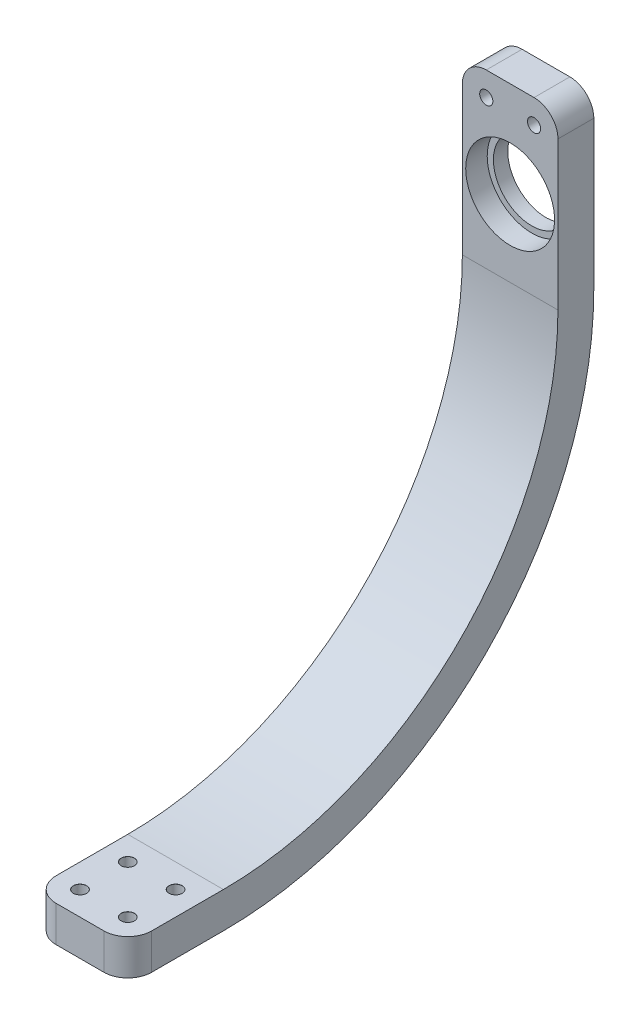
from build123d import *

# Parameters (mm, degrees)
BOSS_EXTRUDE2_DEPTH            = 40
M5_CLEARANCE_HOLE2_D           = 5.5
M5_CLEARANCE_HOLE2_CSINK_D     = 5.55
M5_CLEARANCE_HOLE2_CSINK_ANGLE = 90
CUT_EXTRUDE1_REACH             = 303.917
SKETCH10_R                     = 16
SKETCH11_R                     = 18.6
CUT_EXTRUDE2_DEPTH             = 9
FILLET1_R                      = 10
M5_CLEARANCE_HOLE3_D           = 5.5
M5_CLEARANCE_HOLE3_CSINK_D     = 5.55
M5_CLEARANCE_HOLE3_CSINK_ANGLE = 90


with BuildPart() as part:
    # Sketch6 → Boss-Extrude2 (new body)
    with BuildSketch(Plane(origin=(0, 0, 0), x_dir=(0, 0, -1), z_dir=(1, 0, 0))):
        with BuildLine():
            Line((0, 0), (40, 0))
            ThreePointArc((40, 0), (149.601551084, 45.398448916), (195, 155))
            Line((195, 155), (195, 227))
            Line((195, 227), (180, 227))
            Line((180, 227), (180, 155))
            ThreePointArc((180, 155), (138.994949366, 56.005050634), (40, 15))
            Line((40, 15), (0, 15))
            Line((0, 15), (0, 0))
        make_face()
    extrude(amount=BOSS_EXTRUDE2_DEPTH)

    # M5 Clearance Hole2 (through all)
    with Locations(Plane(origin=(0, 15, 0), x_dir=(1, 0, 0), z_dir=(0, 1, 0))):
        with Locations((10, 30), (30, 30), (10, 10), (30, 10)):
            CounterSinkHole(M5_CLEARANCE_HOLE2_D / 2, M5_CLEARANCE_HOLE2_CSINK_D / 2, counter_sink_angle=M5_CLEARANCE_HOLE2_CSINK_ANGLE)

    # Sketch10 → Cut-Extrude1 (cut, up to next)
    with BuildSketch(Plane(origin=(0, 0, -195), x_dir=(-1, 0, 0), z_dir=(0, 0, -1)), mode=Mode.PRIVATE) as cut_extrude1_sk1:
        with Locations((-20, 187)):
            Circle(SKETCH10_R)
    cut_extrude1_tool1 = extrude(cut_extrude1_sk1.sketch, amount=-CUT_EXTRUDE1_REACH, mode=Mode.PRIVATE) & part.part
    add(cut_extrude1_tool1.solids().sort_by_distance((20, 187, -195))[0], mode=Mode.SUBTRACT)

    # Sketch11 → Cut-Extrude2 (cut)
    with BuildSketch(Plane(origin=(0, 0, -180), x_dir=(-1, 0, 0), z_dir=(0, 0, -1))):
        with Locations((-20, 187)):
            Circle(SKETCH11_R)
    extrude(amount=CUT_EXTRUDE2_DEPTH, mode=Mode.SUBTRACT)

    # Fillet1
    fillet1_edges = [part.edges().sort_by_distance(p)[0] for p in [
        (40, 7.5, 0),
        (0, 7.5, 0),
        (40, 227, -187.5),
        (0, 227, -187.5),
    ]]
    fillet(fillet1_edges, radius=FILLET1_R)

    # M5 Clearance Hole3 (through all)
    with Locations(Plane(origin=(0, 0, -195), x_dir=(-1, 0, 0), z_dir=(0, 0, -1))):
        with Locations((-30, 217), (-10, 217)):
            CounterSinkHole(M5_CLEARANCE_HOLE3_D / 2, M5_CLEARANCE_HOLE3_CSINK_D / 2, counter_sink_angle=M5_CLEARANCE_HOLE3_CSINK_ANGLE)


solid = part.part
